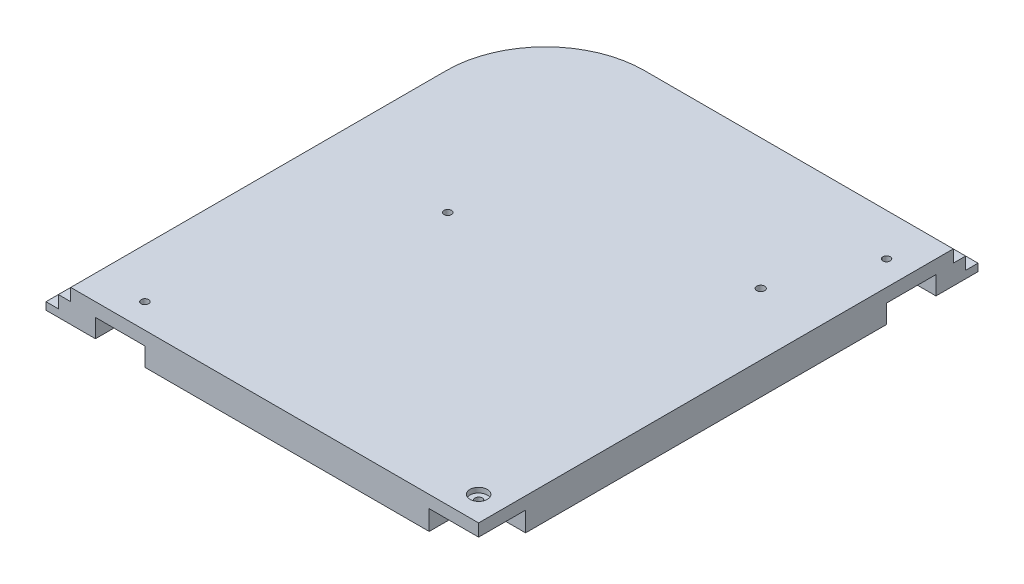
from build123d import *

# Parameters (mm, degrees)
SALIENTE_EXTRUIR1_DEPTH = 3
SALIENTE_EXTRUIR2_DEPTH = 5
SALIENTE_EXTRUIR3_DEPTH = 5
CROQUIS6_R              = 2.25
CORTAR_EXTRUIR3_DEPTH   = 5
CROQUIS7_R              = 1.5
CORTAR_EXTRUIR4_DEPTH   = 286.340147894
CORTAR_EXTRUIR5_DEPTH   = 8
CROQUIS9_R              = 1.5
CORTAR_EXTRUIR6_DEPTH   = 286.340147894
CROQUIS10_W             = 25
CROQUIS10_H             = 50
CORTAR_EXTRUIR7_DEPTH   = 5
CHAFL_N1_SIZE           = 5
CROQUIS13_R             = 3.5
CROQUIS13_R_2           = 2.25
SALIENTE_EXTRUIR4_DEPTH = 25
CROQUIS14_R             = 3
CROQUIS14_R_2           = 1.25
CROQUIS14_R_3           = 1.5
SALIENTE_EXTRUIR5_DEPTH = 10
CROQUIS12_R             = 1.6
CORTAR_EXTRUIR9_DEPTH   = 287.138078556
CROQUIS11_R             = 6
CORTAR_EXTRUIR8_DEPTH   = 5
CROQUIS16_W             = 40
CROQUIS16_H             = 8
CORTAR_EXTRUIR10_DEPTH  = 20
CORTAR_EXTRUIR11_DEPTH  = 30
CROQUIS19_R             = 1.5
CORTAR_EXTRUIR12_DEPTH  = 70
CROQUIS20_W             = 20
CROQUIS20_H             = 7.5
CORTAR_EXTRUIR13_DEPTH  = 20
CROQUIS21_W             = 20
CROQUIS21_H             = 7.5
CORTAR_EXTRUIR14_DEPTH  = 20
CROQUIS22_R             = 16
CORTAR_EXTRUIR15_DEPTH  = 6
CROQUIS23_R             = 3.5
CORTAR_EXTRUIR16_DEPTH  = 2


with BuildPart() as part:
    # Croquis1 → Saliente-Extruir1 (new body)
    with BuildSketch(Plane(origin=(0, 0, 0), x_dir=(1, 0, 0), z_dir=(0, 1, 0))):
        with BuildLine():
            Line((125, 225), (-125, 225))
            ThreePointArc((-125, 225), (-160.355339059, 210.355339059), (-175, 175))
            Line((-175, 175), (-175, -175))
            ThreePointArc((-175, -175), (-160.355339059, -210.355339059), (-125, -225))
            Line((-125, -225), (125, -225))
            ThreePointArc((125, -225), (160.355339059, -210.355339059), (175, -175))
            Line((175, -175), (175, 175))
            ThreePointArc((175, 175), (160.355339059, 210.355339059), (125, 225))
        make_face()
    extrude(amount=SALIENTE_EXTRUIR1_DEPTH)

    # Croquis2 → Saliente-Extruir2 (add)
    with BuildSketch(Plane(origin=(0, 3, 0), x_dir=(1, 0, 0), z_dir=(0, 1, 0))):
        with BuildLine():
            Line((-125, -220), (125, -220))
            ThreePointArc((125, -220), (156.819805153, -206.819805153), (170, -175))
            Line((170, -175), (170, 175))
            ThreePointArc((170, 175), (156.819805153, 206.819805153), (125, 220))
            Line((125, 220), (-125, 220))
            ThreePointArc((-125, 220), (-156.819805153, 206.819805153), (-170, 175))
            Line((-170, 175), (-170, -175))
            ThreePointArc((-170, -175), (-156.819805153, -206.819805153), (-125, -220))
        make_face()
    extrude(amount=SALIENTE_EXTRUIR2_DEPTH)

    # Croquis3 → Saliente-Extruir3 (add)
    with BuildSketch(Plane(origin=(0, 8, 0), x_dir=(1, 0, 0), z_dir=(0, 1, 0))):
        with BuildLine():
            Line((-125, -215), (125, -215))
            ThreePointArc((125, -215), (153.284271247, -203.284271247), (165, -175))
            Line((165, -175), (165, 175))
            ThreePointArc((165, 175), (153.284271247, 203.284271247), (125, 215))
            Line((125, 215), (-125, 215))
            ThreePointArc((-125, 215), (-153.284271247, 203.284271247), (-165, 175))
            Line((-165, 175), (-165, -175))
            ThreePointArc((-165, -175), (-153.284271247, -203.284271247), (-125, -215))
        make_face()
    extrude(amount=SALIENTE_EXTRUIR3_DEPTH)

    # Croquis6 → Cortar-Extruir3 (cut)
    with BuildSketch(Plane(origin=(0, 13, 0), x_dir=(1, 0, 0), z_dir=(0, 1, 0))):
        with Locations(Location((-87, -130, 0), (0, 0, 270))):
            Circle(CROQUIS6_R)
        with Locations(Location((-87, -70, 0), (0, 0, 270))):
            Circle(CROQUIS6_R)
        with Locations(Location((-87, -10, 0), (0, 0, 270))):
            Circle(CROQUIS6_R)
        with Locations(Location((87, -130, 0), (0, 0, 90))):
            Circle(CROQUIS6_R)
        with Locations(Location((87, -70, 0), (0, 0, 90))):
            Circle(CROQUIS6_R)
        with Locations(Location((87, -10, 0), (0, 0, 90))):
            Circle(CROQUIS6_R)
    extrude(amount=-CORTAR_EXTRUIR3_DEPTH, mode=Mode.SUBTRACT)

    # Croquis7 → Cortar-Extruir4 (cut, through all)
    with BuildSketch(Plane(origin=(0, 13, 0), x_dir=(1, 0, 0), z_dir=(0, 1, 0))):
        with Locations(Location((-115, -70, 0), (0, 0, 270))):
            Circle(CROQUIS7_R)
        with Locations(Location((-115, 125.5, 0), (0, 0, 270))):
            Circle(CROQUIS7_R)
        with Locations(Location((115, -70, 0), (0, 0, 90))):
            Circle(CROQUIS7_R)
        with Locations(Location((115, 125.5, 0), (0, 0, 90))):
            Circle(CROQUIS7_R)
    extrude(amount=-CORTAR_EXTRUIR4_DEPTH, mode=Mode.SUBTRACT)

    # Croquis8 → Cortar-Extruir5 (cut)
    with BuildSketch(Plane(origin=(0, 13, 0), x_dir=(1, 0, 0), z_dir=(0, 1, 0))):
        with BuildLine():
            Line((16.014653583, -158), (16.014653583, -178))
            ThreePointArc((16.014653583, -178), (13.014653583, -181), (10.014653583, -178))
            Line((10.014653583, -178), (10.014653583, -158))
            ThreePointArc((10.014653583, -158), (13.014653583, -155), (16.014653583, -158))
        make_face()
        with BuildLine():
            Line((28.014653583, -158), (28.014653583, -178))
            ThreePointArc((28.014653583, -178), (25.014653583, -181), (22.014653583, -178))
            Line((22.014653583, -178), (22.014653583, -158))
            ThreePointArc((22.014653583, -158), (25.014653583, -155), (28.014653583, -158))
        make_face()
        with BuildLine():
            Line((28.014653583, -106), (28.014653583, -126))
            ThreePointArc((28.014653583, -126), (25.014653583, -129), (22.014653583, -126))
            Line((22.014653583, -126), (22.014653583, -106))
            ThreePointArc((22.014653583, -106), (25.014653583, -103), (28.014653583, -106))
        make_face()
        with BuildLine():
            Line((16.014653583, -106), (16.014653583, -126))
            ThreePointArc((16.014653583, -126), (13.014653583, -129), (10.014653583, -126))
            Line((10.014653583, -126), (10.014653583, -106))
            ThreePointArc((10.014653583, -106), (13.014653583, -103), (16.014653583, -106))
        make_face()
    extrude(amount=-CORTAR_EXTRUIR5_DEPTH, mode=Mode.SUBTRACT)

    # Croquis9 → Cortar-Extruir6 (cut, through all)
    with BuildSketch(Plane(origin=(0, 13, 0), x_dir=(1, 0, 0), z_dir=(0, 1, 0))):
        with Locations(Location((13.014653583, -168, 0), (0, 0, 270))):
            Circle(CROQUIS9_R)
        with Locations(Location((25.014653583, -168, 0), (0, 0, 270))):
            Circle(CROQUIS9_R)
        with Locations(Location((13.014653583, -116, 0), (0, 0, 270))):
            Circle(CROQUIS9_R)
        with Locations(Location((25.014653583, -116, 0), (0, 0, 270))):
            Circle(CROQUIS9_R)
        with Locations(Location((-87, -130, 0), (0, 0, 270))):
            Circle(CROQUIS9_R)
        with Locations(Location((-87, -70, 0), (0, 0, 270))):
            Circle(CROQUIS9_R)
        with Locations(Location((-87, -10, 0), (0, 0, 270))):
            Circle(CROQUIS9_R)
        with Locations(Location((87, -10, 0), (0, 0, 270))):
            Circle(CROQUIS9_R)
        with Locations(Location((87, -70, 0), (0, 0, 270))):
            Circle(CROQUIS9_R)
        with Locations(Location((87, -130, 0), (0, 0, 270))):
            Circle(CROQUIS9_R)
    extrude(amount=-CORTAR_EXTRUIR6_DEPTH, mode=Mode.SUBTRACT)

    # Croquis10 → Cortar-Extruir7 (cut)
    with BuildSketch(Plane(origin=(0, 13, 0), x_dir=(1, 0, 0), z_dir=(0, 1, 0))):
        with Locations((62.5, -145)):
            Rectangle(CROQUIS10_W, CROQUIS10_H)
    extrude(amount=-CORTAR_EXTRUIR7_DEPTH, mode=Mode.SUBTRACT)

    # Chaflán1
    chafl_n1_edges = [part.edges().sort_by_distance(p)[0] for p in [
        (62.5, 13, 120),
        (50, 13, 145),
        (62.5, 13, 170),
        (75, 13, 145),
    ]]
    chamfer(chafl_n1_edges, length=CHAFL_N1_SIZE - 0.0001)  # a hair under: the kernel refuses the full size

    # Croquis13 → Saliente-Extruir4 (add)
    # profile 1 of 4: a face of its own
    with BuildSketch(Plane(origin=(0, 13, 0), x_dir=(1, 0, 0), z_dir=(0, 1, 0))):
        with Locations(Location((-20, -50, 0), (0, 0, 270))):
            Circle(CROQUIS13_R)
        with Locations(Location((-20, -50, 0), (0, 0, 270))):
            Circle(CROQUIS13_R_2, mode=Mode.SUBTRACT)
    # profile 2 of 4: a face of its own
    with BuildSketch(Plane(origin=(0, 13, 0), x_dir=(1, 0, 0), z_dir=(0, 1, 0))):
        with Locations(Location((-60, -50, 0), (0, 0, 270))):
            Circle(CROQUIS13_R)
        with Locations(Location((-60, -50, 0), (0, 0, 270))):
            Circle(CROQUIS13_R_2, mode=Mode.SUBTRACT)
    # profile 3 of 4: a face of its own
    with BuildSketch(Plane(origin=(0, 13, 0), x_dir=(1, 0, 0), z_dir=(0, 1, 0))):
        with Locations(Location((-60, -90, 0), (0, 0, 270))):
            Circle(CROQUIS13_R)
        with Locations(Location((-60, -90, 0), (0, 0, 270))):
            Circle(CROQUIS13_R_2, mode=Mode.SUBTRACT)
    # profile 4 of 4: a face of its own
    with BuildSketch(Plane(origin=(0, 13, 0), x_dir=(1, 0, 0), z_dir=(0, 1, 0))):
        with Locations(Location((-20, -90, 0), (0, 0, 270))):
            Circle(CROQUIS13_R)
        with Locations(Location((-20, -90, 0), (0, 0, 270))):
            Circle(CROQUIS13_R_2, mode=Mode.SUBTRACT)
    extrude(amount=SALIENTE_EXTRUIR4_DEPTH)

    # Croquis14 → Saliente-Extruir5 (add)
    # profile 1 of 6: a face of its own
    with BuildSketch(Plane(origin=(0, 13, 0), x_dir=(1, 0, 0), z_dir=(0, 1, 0))):
        with Locations(Location((67.55, -40, 0), (0, 0, 270))):
            Circle(CROQUIS14_R)
        with Locations(Location((67.55, -40, 0), (0, 0, 270))):
            Circle(CROQUIS14_R_2, mode=Mode.SUBTRACT)
    # profile 2 of 6: a face of its own
    with BuildSketch(Plane(origin=(0, 13, 0), x_dir=(1, 0, 0), z_dir=(0, 1, 0))):
        with Locations(Location((3.15, -40, 0), (0, 0, 270))):
            Circle(CROQUIS14_R)
        with Locations(Location((3.15, -40, 0), (0, 0, 270))):
            Circle(CROQUIS14_R_2, mode=Mode.SUBTRACT)
    # profile 3 of 6: a face of its own
    with BuildSketch(Plane(origin=(0, 13, 0), x_dir=(1, 0, 0), z_dir=(0, 1, 0))):
        with Locations(Location((3, -91.9, 0), (0, 0, 270))):
            Circle(CROQUIS14_R)
        with Locations(Location((3, -91.9, 0), (0, 0, 270))):
            Circle(CROQUIS14_R_2, mode=Mode.SUBTRACT)
    # profile 4 of 6: a face of its own
    with BuildSketch(Plane(origin=(0, 13, 0), x_dir=(1, 0, 0), z_dir=(0, 1, 0))):
        with Locations(Location((67.4, -91.9, 0), (0, 0, 270))):
            Circle(CROQUIS14_R)
        with Locations(Location((67.4, -91.9, 0), (0, 0, 270))):
            Circle(CROQUIS14_R_2, mode=Mode.SUBTRACT)
    # profile 5 of 6: a face of its own
    with BuildSketch(Plane(origin=(0, 13, 0), x_dir=(1, 0, 0), z_dir=(0, 1, 0))):
        with Locations(Location((-10, -102.9, 0), (0, 0, 270))):
            Circle(CROQUIS14_R)
        with Locations(Location((-10, -102.9, 0), (0, 0, 270))):
            Circle(CROQUIS14_R_3, mode=Mode.SUBTRACT)
    # profile 6 of 6: a face of its own
    with BuildSketch(Plane(origin=(0, 13, 0), x_dir=(1, 0, 0), z_dir=(0, 1, 0))):
        with Locations(Location((-10, -118.108484849, 0), (0, 0, 270))):
            Circle(CROQUIS14_R)
        with Locations(Location((-10, -118.108484849, 0), (0, 0, 270))):
            Circle(CROQUIS14_R_3, mode=Mode.SUBTRACT)
    extrude(amount=SALIENTE_EXTRUIR5_DEPTH)

    # Croquis12 → Cortar-Extruir9 (cut, through all)
    with BuildSketch(Plane(origin=(0, 13, 0), x_dir=(1, 0, 0), z_dir=(0, 1, 0))):
        with Locations(Location((-25.1, 162.2, 0), (0, 0, 270))):
            Circle(CROQUIS12_R)
        with Locations(Location((25.1, 162.2, 0), (0, 0, 270))):
            Circle(CROQUIS12_R)
        with Locations(Location((-25.1, 12, 0), (0, 0, 270))):
            Circle(CROQUIS12_R)
        with Locations(Location((25.1, 12, 0), (0, 0, 270))):
            Circle(CROQUIS12_R)
    extrude(amount=-CORTAR_EXTRUIR9_DEPTH, mode=Mode.SUBTRACT)

    # Croquis11 → Cortar-Extruir8 (cut)
    with BuildSketch(Plane.XZ):
        with Locations(Location((87, 130, 0), (0, 0, 270))):
            Circle(CROQUIS11_R)
        with Locations(Location((87, 70, 0), (0, 0, 270))):
            Circle(CROQUIS11_R)
        with Locations(Location((87, 10, 0), (0, 0, 270))):
            Circle(CROQUIS11_R)
        with Locations(Location((-87, 10, 0), (0, 0, 270))):
            Circle(CROQUIS11_R)
        with Locations(Location((-87, 70, 0), (0, 0, 270))):
            Circle(CROQUIS11_R)
        with Locations(Location((-87, 130, 0), (0, 0, 270))):
            Circle(CROQUIS11_R)
        with Locations(Location((-115, 70, 0), (0, 0, 270))):
            Circle(CROQUIS11_R)
        with Locations(Location((115, 70, 0), (0, 0, 270))):
            Circle(CROQUIS11_R)
        with Locations(Location((115, -125.5, 0), (0, 0, 270))):
            Circle(CROQUIS11_R)
        with Locations(Location((-115, -125.5, 0), (0, 0, 270))):
            Circle(CROQUIS11_R)
        with Locations(Location((-25.1, -162.2, 0), (0, 0, 270))):
            Circle(CROQUIS11_R)
        with Locations(Location((25.1, -162.2, 0), (0, 0, 270))):
            Circle(CROQUIS11_R)
        with Locations(Location((-25.1, -12, 0), (0, 0, 270))):
            Circle(CROQUIS11_R)
        with Locations(Location((25.1, -12, 0), (0, 0, 270))):
            Circle(CROQUIS11_R)
        with BuildLine():
            Line((13.014653583, 188), (25.014653583, 188))
            ThreePointArc((25.014653583, 188), (45.014653583, 168), (25.014653583, 148))
            Line((25.014653583, 148), (13.014653583, 148))
            ThreePointArc((13.014653583, 148), (-6.985346417, 168), (13.014653583, 188))
        make_face()
        with BuildLine():
            Line((13.014653583, 136), (25.014653583, 136))
            ThreePointArc((25.014653583, 136), (45.014653583, 116), (25.014653583, 96))
            Line((25.014653583, 96), (13.014653583, 96))
            ThreePointArc((13.014653583, 96), (-6.985346417, 116), (13.014653583, 136))
        make_face()
    extrude(amount=-CORTAR_EXTRUIR8_DEPTH, mode=Mode.SUBTRACT)

    # Croquis16 → Cortar-Extruir10 (cut, symmetric)
    with BuildSketch(Plane(origin=(0, 0, 0), x_dir=(0, 0, -1), z_dir=(1, 0, 0))):
        with Locations((22, 4)):
            Rectangle(CROQUIS16_W, CROQUIS16_H)
    extrude(amount=CORTAR_EXTRUIR10_DEPTH, both=True, mode=Mode.SUBTRACT)

    # Croquis17 → Cortar-Extruir11 (cut, symmetric)
    with BuildSketch(Plane(origin=(0, 13, 0), x_dir=(1, 0, 0), z_dir=(0, 1, 0))):
        Polygon((-175, 23), (0, 23), (0, 225), (175, 225), (175, 23), (175, -225), (0, -225), (-175, -225), align=None)
    extrude(amount=CORTAR_EXTRUIR11_DEPTH, both=True, mode=Mode.SUBTRACT)

    # Croquis19 → Cortar-Extruir12 (cut)
    with BuildSketch(Plane(origin=(0, 13, 0), x_dir=(1, 0, 0), z_dir=(0, 1, 0))):
        with Locations(Location((-10, 33, 0), (0, 0, 270))):
            Circle(CROQUIS19_R)
        with Locations(Location((-10, 198, 0), (0, 0, 270))):
            Circle(CROQUIS19_R)
        with Locations(Location((-145, 33, 0), (0, 0, 270))):
            Circle(CROQUIS19_R)
    extrude(amount=-CORTAR_EXTRUIR12_DEPTH, mode=Mode.SUBTRACT)

    # Croquis20 → Cortar-Extruir13 (cut)
    with BuildSketch(Plane(origin=(0, 0, 0), x_dir=(0, 0, -1), z_dir=(1, 0, 0))):
        with Locations((198, 3.75)):
            Rectangle(CROQUIS20_W, CROQUIS20_H)
    extrude(amount=-CORTAR_EXTRUIR13_DEPTH, mode=Mode.SUBTRACT)

    # Croquis21 → Cortar-Extruir14 (cut)
    with BuildSketch(Plane.XY.offset(-23)):
        with Locations((-145, 3.75)):
            Rectangle(CROQUIS21_W, CROQUIS21_H)
    extrude(amount=-CORTAR_EXTRUIR14_DEPTH, mode=Mode.SUBTRACT)

    # Croquis22 → Cortar-Extruir15 (cut)
    with BuildSketch(Plane.XZ):
        with BuildLine():
            Line((-27, -181), (-7, -181))
            Line((-7, -181), (-7, -49))
            Line((-7, -49), (-27, -49))
            Line((-27, -49), (-27, -30))
            Line((-27, -30), (-128, -30))
            Line((-128, -30), (-128, -50))
            Line((-128, -50), (-162, -50))
            Line((-162, -50), (-162, -30))
            Line((-162, -30), (-168, -30))
            Line((-168, -30), (-168, -175))
            ThreePointArc((-168, -175), (-155.405591591, -205.405591591), (-125, -218))
            Line((-125, -218), (-7, -218))
            Line((-7, -218), (-7, -215))
            Line((-7, -215), (-27, -215))
            Line((-27, -215), (-27, -181))
        make_face()
        with Locations(Location((-115, -125.5, 0), (0, 0, 270))):
            Circle(CROQUIS22_R, mode=Mode.SUBTRACT)
        with Locations(Location((-25.1, -162.2, 0), (0, 0, 270))):
            Circle(CROQUIS22_R, mode=Mode.SUBTRACT)
    extrude(amount=-CORTAR_EXTRUIR15_DEPTH, mode=Mode.SUBTRACT)

    # Croquis23 → Cortar-Extruir16 (cut)
    with BuildSketch(Plane(origin=(0, 13, 0), x_dir=(1, 0, 0), z_dir=(0, 1, 0))):
        with Locations(Location((-10, 33, 0), (0, 0, 270))):
            Circle(CROQUIS23_R)
    extrude(amount=-CORTAR_EXTRUIR16_DEPTH, mode=Mode.SUBTRACT)


solid = part.part
